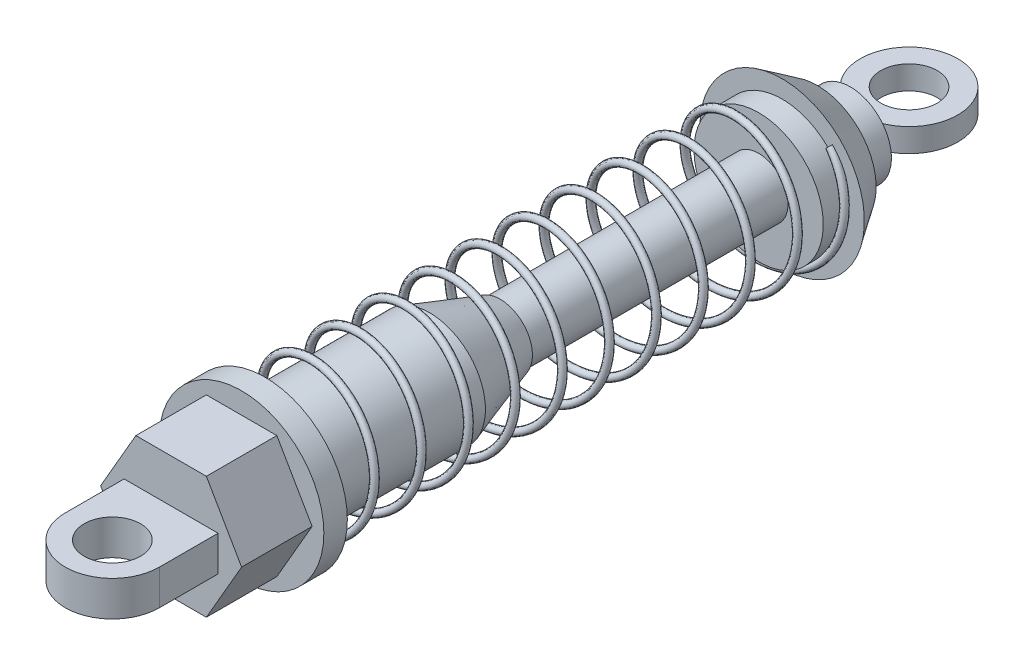
from build123d import *

# Parameters (mm, degrees)
CROQUIS1_R              = 7
SALIENTE_EXTRUIR1_DEPTH = 2
SALIENTE_EXTRUIR2_DEPTH = 6
SALIENTE_EXTRUIR3_DEPTH = 1.5
CROQUIS6_R              = 2.4
CORTAR_EXTRUIR1_DEPTH   = 3
CROQUIS7_R              = 4.75
SALIENTE_EXTRUIR4_DEPTH = 20
CROQUIS8_R              = 2.5
CORTAR_EXTRUIR2_DEPTH   = 20
BARRER1_PITCH           = 4
SALIENTE_EXTRUIR5_START = 3
CROQUIS13_R             = 7
SALIENTE_EXTRUIR5_DEPTH = 3
CROQUIS15_R             = 5.5
SALIENTE_EXTRUIR6_DEPTH = 2
CROQUIS16_R             = 2.5
SALIENTE_EXTRUIR7_DEPTH = 24
CROQUIS18_R             = 3.5
SALIENTE_EXTRUIR8_DEPTH = 2.8
CROQUIS19_R             = 2.4
SALIENTE_EXTRUIR9_DEPTH = 1


with BuildPart() as part:
    # Croquis1 → Saliente-Extruir1 (new body)
    with BuildSketch(Plane.XY):
        Circle(CROQUIS1_R)
    extrude(amount=SALIENTE_EXTRUIR1_DEPTH)

    # Croquis2 → Saliente-Extruir2 (add)
    with BuildSketch(Plane.XY.offset(2)):
        Polygon((-3, 5.196152423), (-6, 0), (-3, -5.196152423), (3, -5.196152423), (6, 0), (3, 5.196152423), align=None)
    extrude(amount=SALIENTE_EXTRUIR2_DEPTH)

    # Croquis4 → Saliente-Extruir3 (add, symmetric)
    with BuildSketch(Plane(origin=(0, 0, 0), x_dir=(1, 0, 0), z_dir=(0, 1, 0))):
        with BuildLine():
            Line((-4, -8), (4, -8))
            Line((4, -8), (4, -13))
            ThreePointArc((4, -13), (0, -17), (-4, -13))
            Line((-4, -13), (-4, -8))
        make_face()
    extrude(amount=SALIENTE_EXTRUIR3_DEPTH, both=True)

    # Croquis6 → Cortar-Extruir1 (cut)
    with BuildSketch(Plane(origin=(0, 1.5, 0), x_dir=(1, 0, 0), z_dir=(0, 1, 0))):
        with Locations(Location((0, -13, 0), (0, 0, 270))):
            Circle(CROQUIS6_R)
    extrude(amount=-CORTAR_EXTRUIR1_DEPTH, mode=Mode.SUBTRACT)

    # Croquis7 → Saliente-Extruir4 (add)
    with BuildSketch(Plane(origin=(0, 0, 0), x_dir=(-1, 0, 0), z_dir=(0, 0, -1))):
        Circle(CROQUIS7_R)
    extrude(amount=SALIENTE_EXTRUIR4_DEPTH)

    # Croquis8 → Cortar-Extruir2 (cut)
    with BuildSketch(Plane(origin=(0, 0, -20), x_dir=(-1, 0, 0), z_dir=(0, 0, -1))):
        Circle(CROQUIS8_R)
    extrude(amount=-CORTAR_EXTRUIR2_DEPTH, mode=Mode.SUBTRACT)

    # Barrer1: arcs per turn and ends read off the stored shape
    # Barrer1: the profile of Croquis12 screwed along a left-hand helix through 11 turns, 12 arcs to a turn; built about Z, then put on its axis
    barrer1_z = Axis((0, 0, 0), (0, 0, 1))
    barrer1_corners = [(5.749245229, 0, 0.31006718), (6.049245229, 0, 0.01006718), (5.749245229, 0, -0.28993282), (5.449245229, 0, 0.01006718)]
    with BuildLine(mode=Mode.PRIVATE) as barrer1_profile:
        ThreePointArc((5.749245229, 0, 0.31006718), (5.961377263, 0, 0.222199214), (6.049245229, 0, 0.01006718))
        ThreePointArc((6.049245229, 0, 0.01006718), (5.961377263, 0, -0.202064854), (5.749245229, 0, -0.28993282))
        ThreePointArc((5.749245229, 0, -0.28993282), (5.537113195, 0, -0.202064854), (5.449245229, 0, 0.01006718))
        ThreePointArc((5.449245229, 0, 0.01006718), (5.537113195, 0, 0.222199214), (5.749245229, 0, 0.31006718))
    barrer1_cap = Face(barrer1_profile.wire())
    barrer1_arcs = [((5.749245229, 0, 0.31006718), (6.049245229, 0, 0.31006718), (6.049245229, 0, 0.01006718), (1, 0.7071067811865476, 1)), ((6.049245229, 0, 0.01006718), (6.049245229, 0, -0.28993282), (5.749245229, 0, -0.28993282), (1, 0.7071067811865476, 1)), ((5.749245229, 0, -0.28993282), (5.449245229, 0, -0.28993282), (5.449245229, 0, 0.01006718), (1, 0.7071067811865476, 1)), ((5.449245229, 0, 0.01006718), (5.449245229, 0, 0.31006718), (5.749245229, 0, 0.31006718), (1, 0.7071067811865476, 1))]  # start, shoulder, end, weights
    barrer1_turn_angles = [0, -15, -30, -45, -60, -75, -90, -105, -120, -135, -150, -165, -180, -195, -210, -225, -240, -255, -270, -285, -300, -315, -330, -345, -360]
    barrer1_turn_weights = [1, 0.9659258262890683, 1, 0.9659258262890683, 1, 0.9659258262890683, 1, 0.9659258262890683, 1, 0.9659258262890683, 1, 0.9659258262890683, 1, 0.9659258262890683, 1, 0.9659258262890683, 1, 0.9659258262890683, 1, 0.9659258262890683, 1, 0.9659258262890683, 1, 0.9659258262890683, 1]
    barrer1_turn_sides = [Face.make_bezier_surface([[Vector(p[j][0], p[j][1], 0).rotate(barrer1_z, barrer1_turn_angles[2 * i + k]) / barrer1_turn_weights[2 * i + k] + Vector(0, 0, p[j][2] + -BARRER1_PITCH * barrer1_turn_angles[2 * i + k] / 360) for k in range(3)] for j in range(3)], [[p[3][j] * barrer1_turn_weights[2 * i + k] for k in range(3)] for j in range(3)]) for p in barrer1_arcs for i in range(12)]
    barrer1 = Plane(origin=(0, 0, 0), x_dir=(0.7071067811865512, 0.7071067811865439, 0), z_dir=(0, 0, -1)) * Solid(Shell([*[p.moved(Location((0, 0, BARRER1_PITCH * i))) for i in range(11) for p in barrer1_turn_sides], barrer1_cap, barrer1_cap.rotate(barrer1_z, -3960).moved(Location((0, 0, -BARRER1_PITCH * -3960 / 360)))]))
    add(barrer1)

    # Croquis13 → Saliente-Extruir5 (add)
    with BuildSketch(Plane(origin=(0, 0, -44), x_dir=(-1, 0, 0), z_dir=(0, 0, -1)).offset(SALIENTE_EXTRUIR5_START)):
        with Locations(Location((0, 0, 0), (0, 0, 180))):
            Circle(CROQUIS13_R)
    extrude(amount=-SALIENTE_EXTRUIR5_DEPTH)

    # Croquis14 → Cortar-Revolución1 (revolve, cut)
    with BuildSketch(Plane(origin=(0, 0, 0), x_dir=(0, 0, -1), z_dir=(1, 0, 0)), mode=Mode.PRIVATE) as cortar_revoluci_n1_sk:
        Polygon((20, -4.75), (20, -2.75), (14, -4.75), align=None)
    revolve(cortar_revoluci_n1_sk.sketch.rotate(Axis((0, 0, -20), (0, 0, 1)), 270), axis=Axis((0, 0, -20), (0, 0, 1)), mode=Mode.SUBTRACT)

    # Croquis15 → Saliente-Extruir6 (add)
    with BuildSketch(Plane.XY.offset(-44)):
        Circle(CROQUIS15_R)
    extrude(amount=SALIENTE_EXTRUIR6_DEPTH)

    # Croquis16 → Saliente-Extruir7 (add)
    with BuildSketch(Plane.XY.offset(-42)):
        with Locations(Location((0, 0, 0), (0, 0, 180))):
            Circle(CROQUIS16_R)
    extrude(amount=SALIENTE_EXTRUIR7_DEPTH)

    # Croquis17 → Cortar-Revolución2 (revolve, cut)
    with BuildSketch(Plane(origin=(0, 0, 0), x_dir=(0, 0, -1), z_dir=(1, 0, 0)), mode=Mode.PRIVATE) as cortar_revoluci_n2_sk:
        Polygon((47, -7), (44, -7), (47, -5), align=None)
    revolve(cortar_revoluci_n2_sk.sketch.rotate(Axis((0, 0, -47), (0, 0, 1)), 270), axis=Axis((0, 0, -47), (0, 0, 1)), mode=Mode.SUBTRACT)

    # Croquis18 → Saliente-Extruir8 (add)
    with BuildSketch(Plane(origin=(0, 0, -47), x_dir=(-1, 0, 0), z_dir=(0, 0, -1))):
        Circle(CROQUIS18_R)
    extrude(amount=SALIENTE_EXTRUIR8_DEPTH)

    # Croquis19 → Saliente-Extruir9 (add, symmetric)
    with BuildSketch(Plane(origin=(0, 0, 0), x_dir=(1, 0, 0), z_dir=(0, 1, 0))):
        with BuildLine():
            Line((-1.5, 49.8), (1.5, 49.8))
            Line((1.5, 49.8), (1.5, 50.930568517))
            ThreePointArc((1.5, 50.930568517), (0, 58.95), (-1.5, 50.930568517))
            Line((-1.5, 50.930568517), (-1.5, 49.8))
        make_face()
        with Locations(Location((0, 54.8, 0), (0, 0, 270))):
            Circle(CROQUIS19_R, mode=Mode.SUBTRACT)
    extrude(amount=SALIENTE_EXTRUIR9_DEPTH, both=True)


solid = part.part
